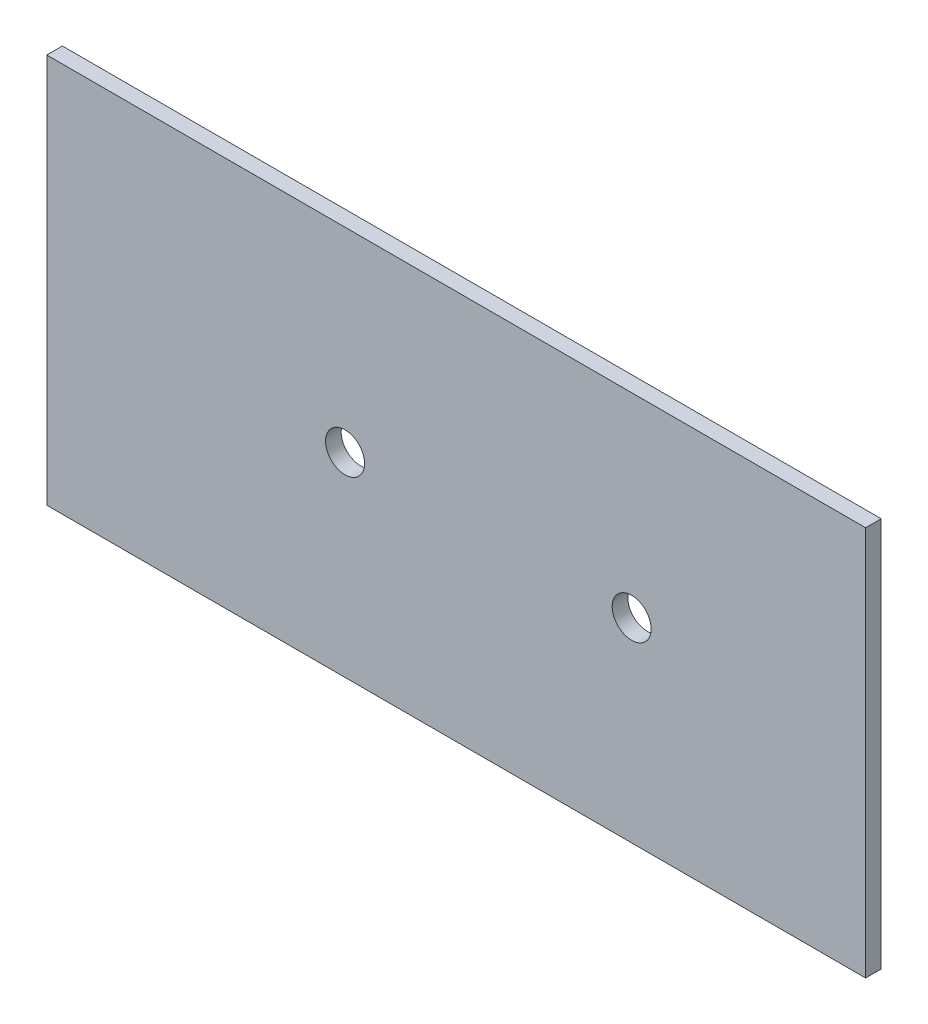
from build123d import *

# Parameters (mm, degrees)
SKETCH1_W           = 210
SKETCH1_H           = 100
SKETCH1_R           = 5
BOSS_EXTRUDE1_DEPTH = 4


with BuildPart() as part:
    # Sketch1 → Boss-Extrude1 (new body)
    with BuildSketch(Plane.XY):
        with Locations((-45, 0)):
            Rectangle(SKETCH1_W, SKETCH1_H)
        Circle(SKETCH1_R, mode=Mode.SUBTRACT)
        with Locations((-73.5, 0)):
            Circle(SKETCH1_R, mode=Mode.SUBTRACT)
    extrude(amount=BOSS_EXTRUDE1_DEPTH)


solid = part.part
